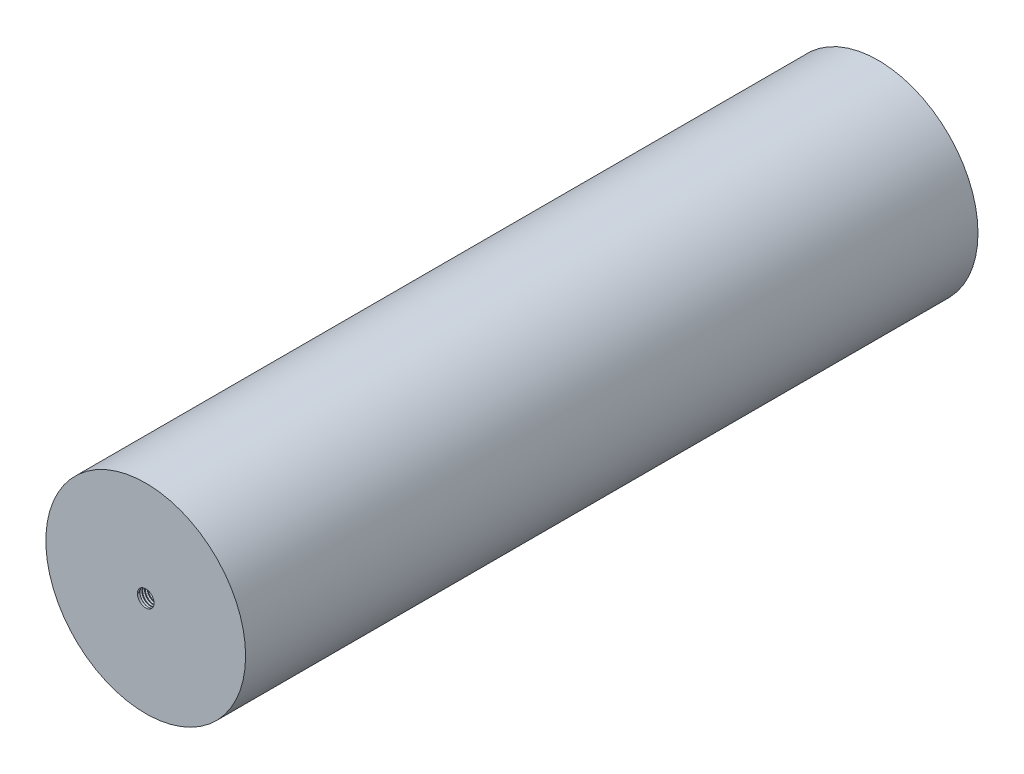
from build123d import *

# Parameters (mm, degrees)
BOSS_EXTRUDE1_DEPTH      = 139.7
BOSS_EXTRUDE1_DEPTH_BACK = 139.7
SKETCH1_R                = 38.1
SKETCH2_R                = 3.175
CUT_EXTRUDE1_DEPTH       = 20
THREAD1_PITCH            = 1
CUT_EXTRUDE2_START       = -20
SKETCH8_R                = 3.175
CUT_EXTRUDE2_DEPTH       = 20
THREAD2_PITCH            = 1


with BuildPart() as part:
    # Sketch1 → Boss-Extrude1 (new, two sides: drawn at the far end of the back side and taken through both)
    with BuildSketch(Plane.XY.offset(-BOSS_EXTRUDE1_DEPTH_BACK)):
        Circle(SKETCH1_R)
    extrude(amount=BOSS_EXTRUDE1_DEPTH + BOSS_EXTRUDE1_DEPTH_BACK)

    # Sketch2 → Cut-Extrude1 (cut)
    with BuildSketch(Plane.XY.offset(139.7)):
        Circle(SKETCH2_R)
    extrude(amount=-CUT_EXTRUDE1_DEPTH, mode=Mode.SUBTRACT)

    # Thread1: the profile of Thread Profile2 profile screwed along a right-hand helix of 20 turns, 8 arcs to a turn; built about Z, then put on its axis
    thread1_z = Axis((0, 0, 0), (0, 0, 1))
    thread1_corners = [(3.1747, 0, -0.000173), (3.716266, 0, 0.3125), (3.716266, 0, 0.4375), (3.1747, 0, 0.750173)]
    with BuildLine(mode=Mode.PRIVATE) as thread1_profile:
        Line(thread1_corners[0], thread1_corners[1])
        Line(thread1_corners[1], thread1_corners[2])
        Line(thread1_corners[2], thread1_corners[3])
        Line(thread1_corners[3], thread1_corners[0])
    thread1_cap = Face(thread1_profile.wire())
    thread1_turn_angles = [0, 22.5, 45, 67.5, 90, 112.5, 135, 157.5, 180, 202.5, 225, 247.5, 270, 292.5, 315, 337.5, 360]
    thread1_turn_weights = [1, 0.9238795325112867, 1, 0.9238795325112867, 1, 0.9238795325112867, 1, 0.9238795325112867, 1, 0.9238795325112867, 1, 0.9238795325112867, 1, 0.9238795325112867, 1, 0.9238795325112867, 1]
    thread1_turn_rails = [Edge.make_bspline([Vector(p[0], p[1], 0).rotate(thread1_z, thread1_turn_angles[k]) / thread1_turn_weights[k] + Vector(0, 0, p[2] + THREAD1_PITCH * thread1_turn_angles[k] / 360) for k in range(17)], [0, 0, 0, 1, 1, 2, 2, 3, 3, 4, 4, 5, 5, 6, 6, 7, 7, 8, 8, 8], 2, thread1_turn_weights) for p in thread1_corners]
    thread1_turn_sides = [Face.make_surface_from_curves(thread1_turn_rails[p[0]], thread1_turn_rails[p[1]]) for p in [(0, 1), (1, 2), (2, 3), (3, 0)]]
    thread1 = Plane(origin=(0, 0, 139.7), x_dir=(-1, 0, 0), z_dir=(0, 0, -1)) * Solid(Shell([*[p.moved(Location((0, 0, THREAD1_PITCH * i))) for i in range(20) for p in thread1_turn_sides], thread1_cap, thread1_cap.rotate(thread1_z, 7200).moved(Location((0, 0, THREAD1_PITCH * 7200 / 360)))]))
    add(thread1, mode=Mode.SUBTRACT)

    # Sketch8 → Cut-Extrude2 (cut)
    with BuildSketch(Plane(origin=(0, 0, -139.7), x_dir=(-1, 0, 0), z_dir=(0, 0, -1)).offset(CUT_EXTRUDE2_START)):
        Circle(SKETCH8_R)
    extrude(amount=CUT_EXTRUDE2_DEPTH, mode=Mode.SUBTRACT)

    # Thread2: the profile of Thread Profile3 profile screwed along a right-hand helix of 20 turns, 8 arcs to a turn; built about Z, then put on its axis
    thread2_z = Axis((0, 0, 0), (0, 0, 1))
    thread2_corners = [(3.1747, 0, -0.000173), (3.716266, 0, 0.3125), (3.716266, 0, 0.4375), (3.1747, 0, 0.750173)]
    with BuildLine(mode=Mode.PRIVATE) as thread2_profile:
        Line(thread2_corners[0], thread2_corners[1])
        Line(thread2_corners[1], thread2_corners[2])
        Line(thread2_corners[2], thread2_corners[3])
        Line(thread2_corners[3], thread2_corners[0])
    thread2_cap = Face(thread2_profile.wire())
    thread2_turn_angles = [0, 22.5, 45, 67.5, 90, 112.5, 135, 157.5, 180, 202.5, 225, 247.5, 270, 292.5, 315, 337.5, 360]
    thread2_turn_weights = [1, 0.9238795325112867, 1, 0.9238795325112867, 1, 0.9238795325112867, 1, 0.9238795325112867, 1, 0.9238795325112867, 1, 0.9238795325112867, 1, 0.9238795325112867, 1, 0.9238795325112867, 1]
    thread2_turn_rails = [Edge.make_bspline([Vector(p[0], p[1], 0).rotate(thread2_z, thread2_turn_angles[k]) / thread2_turn_weights[k] + Vector(0, 0, p[2] + THREAD2_PITCH * thread2_turn_angles[k] / 360) for k in range(17)], [0, 0, 0, 1, 1, 2, 2, 3, 3, 4, 4, 5, 5, 6, 6, 7, 7, 8, 8, 8], 2, thread2_turn_weights) for p in thread2_corners]
    thread2_turn_sides = [Face.make_surface_from_curves(thread2_turn_rails[p[0]], thread2_turn_rails[p[1]]) for p in [(0, 1), (1, 2), (2, 3), (3, 0)]]
    thread2 = Plane(origin=(0, 0, -139.7), x_dir=(1, 0, 0), z_dir=(0, 0, 1)) * Solid(Shell([*[p.moved(Location((0, 0, THREAD2_PITCH * i))) for i in range(20) for p in thread2_turn_sides], thread2_cap, thread2_cap.rotate(thread2_z, 7200).moved(Location((0, 0, THREAD2_PITCH * 7200 / 360)))]))
    add(thread2, mode=Mode.SUBTRACT)


solid = part.part
